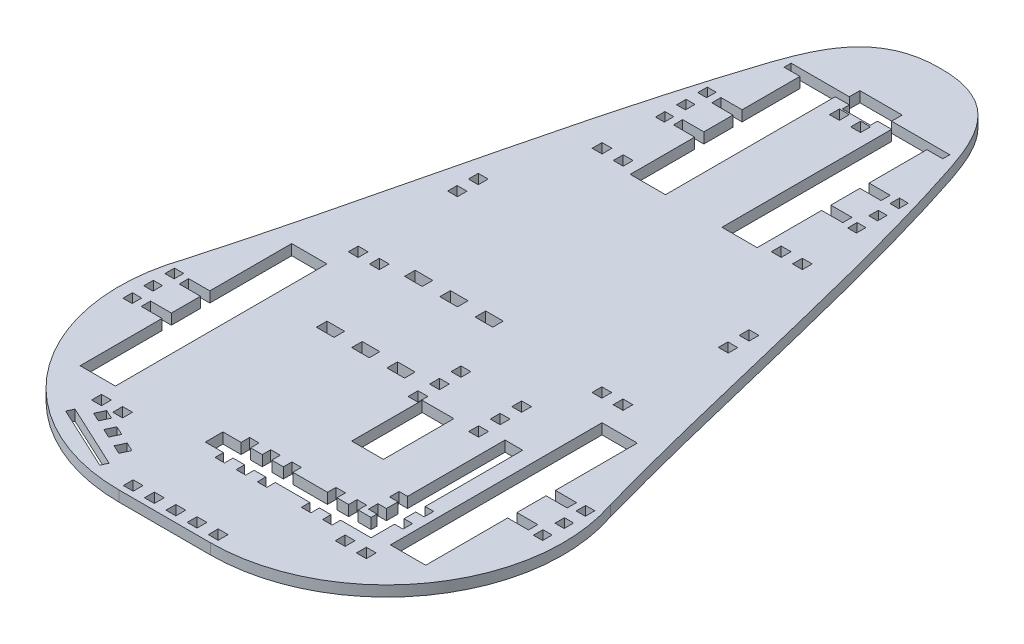
from build123d import *

# Parameters (mm, degrees)
SKETCH1_W           = 2.8
SKETCH1_H           = 2.8
SKETCH1_W_2         = 2.6
SKETCH1_H_2         = 2.7
SKETCH1_W_3         = 5
SKETCH1_H_3         = 3
SKETCH1_W_4         = 2.800000003
SKETCH1_H_4         = 2.800000033
SKETCH1_W_5         = 9
SKETCH1_H_5         = 20
SKETCH1_W_6         = 2.5
BOSS_EXTRUDE1_DEPTH = 3


with BuildPart() as part:
    # Sketch1 → Boss-Extrude1 (new body)
    with BuildSketch(Plane(origin=(0, 0, 0), x_dir=(1, 0, 0), z_dir=(0, 1, 0))):
        with BuildLine():
            ThreePointArc((-5.451969082, 56.808090106), (1.269225254, 11.627257617), (41.903463671, -9.237563161))
            Line((41.903463671, -9.237563161), (44.87196211, -9.237563161))
            Line((44.87196211, -9.237563161), (54.87196211, -9.237563161))
            Line((54.87196211, -9.237563161), (64.87196211, -9.237563161))
            Line((64.87196211, -9.237563161), (67.840460548, -9.237563161))
            ThreePointArc((67.840460548, -9.237563161), (108.474698965, 11.627257617), (115.195893301, 56.808090106))
            add(Edge.make_bspline(
                [(54.87196211, 210.762436839), (55.76190685, 210.762436839), (73.060865178, 210.353018472), (83.092195408, 181.76076755), (97.272209973, 130.317754643), (107.073403848, 85.556994266), (115.195893301, 56.808090106)],
                knots=[0, 0, 0, 0, 0.011071987, 0.221439744, 0.460221348, 1, 1, 1, 1], degree=3))
            add(Edge.make_bspline(
                [(54.87196211, 210.762436839), (53.982017369, 210.762436839), (36.683059042, 210.353018472), (26.651728811, 181.76076755), (12.471714246, 130.317754643), (2.670520371, 85.556994266), (-5.451969082, 56.808090106)],
                knots=[0, 0, 0, 0, 0.011071987, 0.221439744, 0.460221348, 1, 1, 1, 1], degree=3))
        make_face()
        Polygon((33.080876822, -5.87890769), (14.954721126, 2.573457642), (15.799957659, 4.386073211), (33.926113355, -4.06629212), align=None, mode=Mode.SUBTRACT)
        Polygon((24.907374797, 3.44934856), (26.090705944, 5.987010357), (28.628367741, 4.803679211), (27.445036595, 2.266017413), align=None, mode=Mode.SUBTRACT)
        with Locations((17.32012911, 10.362436839)):
            Rectangle(SKETCH1_W, SKETCH1_H, mode=Mode.SUBTRACT)
        Polygon((19.469528089, 5.985058159), (20.652859235, 8.522719957), (23.190521033, 7.33938881), (22.007189886, 4.801727013), align=None, mode=Mode.SUBTRACT)
        with Locations((23.32012911, 10.362436839)):
            Rectangle(SKETCH1_W, SKETCH1_H, mode=Mode.SUBTRACT)
        with Locations((42.82196211, -6.137563532)):
            Rectangle(SKETCH1_W, SKETCH1_H, mode=Mode.SUBTRACT)
        Polygon((30.345221506, 0.91363896), (31.528552652, 3.451300758), (34.06621445, 2.267969611), (32.882883303, -0.269692186), align=None, mode=Mode.SUBTRACT)
        with Locations((48.82196211, -6.137563532)):
            Rectangle(SKETCH1_W, SKETCH1_H, mode=Mode.SUBTRACT)
        with Locations((54.92196211, -6.137563566)):
            Rectangle(SKETCH1_W, SKETCH1_H, mode=Mode.SUBTRACT)
        with Locations((60.92196211, -6.137563532)):
            Rectangle(SKETCH1_W, SKETCH1_H, mode=Mode.SUBTRACT)
        with Locations((-3.328903903, 39.762436839)):
            Rectangle(SKETCH1_W_2, SKETCH1_H_2, mode=Mode.SUBTRACT)
        with Locations((66.92196211, -6.137563532)):
            Rectangle(SKETCH1_W, SKETCH1_H, mode=Mode.SUBTRACT)
        with Locations((86.423795109, 10.362436839)):
            Rectangle(SKETCH1_W, SKETCH1_H, mode=Mode.SUBTRACT)
        with Locations((92.423795109, 10.362436839)):
            Rectangle(SKETCH1_W, SKETCH1_H, mode=Mode.SUBTRACT)
        Polygon((80.72196211, 19.762436839), (84.37196211, 19.762436839), (84.37196211, 21.412436839), (81.97196211, 21.412436839), (81.97196211, 24.112436839), (84.37196211, 24.112436839), (84.37196211, 27.412436839), (81.97196211, 27.412436839), (81.97196211, 30.112436839), (84.37196211, 30.112436839), (84.37196211, 57.762436839), (89.37196211, 57.762436839), (89.37196211, 30.112436839), (91.77196211, 30.112436839), (91.77196211, 27.412436839), (89.37196211, 27.412436839), (89.37196211, 24.112436839), (91.77196211, 24.112436839), (91.77196211, 21.412436839), (89.37196211, 21.412436839), (89.37196211, 19.762436839), (89.37196211, 14.762436839), (84.37196211, 14.762436839), (80.72196211, 14.762436839), (80.72196211, 12.362436839), (78.02196211, 12.362436839), (78.02196211, 14.762436839), (74.72196211, 14.762436839), (74.72196211, 12.362436839), (72.02196211, 12.362436839), (72.02196211, 14.762436839), (62.221962161, 14.762436839), (62.22196211, 12.362436839), (59.52196211, 12.362436839), (59.521962161, 14.762436839), (56.221962161, 14.762436839), (56.22196211, 12.362436839), (53.52196211, 12.362436839), (53.52196211, 14.762436839), (50.22196211, 14.762436839), (50.22196211, 12.362436839), (47.52196211, 12.362436839), (47.52196211, 14.762436839), (42.37196211, 14.762436839), (42.37196211, 19.762436839), (47.52196211, 19.762436839), (47.52196211, 22.162436839), (50.22196211, 22.162436839), (50.22196211, 19.762436839), (53.52196211, 19.762436839), (53.52196211, 22.162436839), (56.22196211, 22.162436839), (56.221962161, 19.762436839), (59.521962161, 19.762436839), (59.52196211, 22.162436839), (62.22196211, 22.162436839), (62.221962161, 19.762436839), (72.02196211, 19.762436839), (72.02196211, 22.162436839), (74.72196211, 22.162436839), (74.72196211, 19.762436839), (78.02196211, 19.762436839), (78.02196211, 22.162436839), (80.72196211, 22.162436839), align=None, mode=Mode.SUBTRACT)
        with Locations((113.072828122, 39.762436839)):
            Rectangle(SKETCH1_W_2, SKETCH1_H_2, mode=Mode.SUBTRACT)
        with Locations((-3.42803789, 45.762436839)):
            Rectangle(SKETCH1_W_2, SKETCH1_H_2, mode=Mode.SUBTRACT)
        with Locations((-3.42803789, 51.762436839)):
            Rectangle(SKETCH1_W_2, SKETCH1_H_2, mode=Mode.SUBTRACT)
        Polygon((5.87196211, 52.537436839), (5.87196211, 75.762436839), (15.87196211, 75.762436839), (15.87196211, 15.762436839), (5.87196211, 15.762436839), (5.87196211, 38.987435462), (-0.028903903, 38.987435462), (-0.028903903, 41.637435462), (5.87196211, 41.637435462), (5.87196211, 49.887436839), (-0.12803789, 49.887436839), (-0.12803789, 52.537436839), align=None, mode=Mode.SUBTRACT)
        with Locations((61.321095984, 56.117167438)):
            Rectangle(SKETCH1_W, SKETCH1_H, mode=Mode.SUBTRACT)
        with Locations((32.421095947, 60.217167702)):
            Rectangle(SKETCH1_W_3, SKETCH1_H_3, mode=Mode.SUBTRACT)
        with Locations((42.421095947, 60.217167702)):
            Rectangle(SKETCH1_W_3, SKETCH1_H_3, mode=Mode.SUBTRACT)
        with Locations((52.421095947, 60.217167702)):
            Rectangle(SKETCH1_W_3, SKETCH1_H_3, mode=Mode.SUBTRACT)
        with Locations((61.321095986, 62.217167405)):
            Rectangle(SKETCH1_W_4, SKETCH1_H, mode=Mode.SUBTRACT)
        with Locations((61.321095986, 68.317167422)):
            Rectangle(SKETCH1_W_4, SKETCH1_H_4, mode=Mode.SUBTRACT)
        with Locations((17.32012911, 83.162436839)):
            Rectangle(SKETCH1_W, SKETCH1_H, mode=Mode.SUBTRACT)
        with Locations((23.32012911, 83.162436839)):
            Rectangle(SKETCH1_W, SKETCH1_H, mode=Mode.SUBTRACT)
        with Locations((32.421095947, 85.217167702)):
            Rectangle(SKETCH1_W_3, SKETCH1_H_3, mode=Mode.SUBTRACT)
        with Locations((42.421095947, 85.217167702)):
            Rectangle(SKETCH1_W_3, SKETCH1_H_3, mode=Mode.SUBTRACT)
        with Locations((52.421095947, 85.217167702)):
            Rectangle(SKETCH1_W_3, SKETCH1_H_3, mode=Mode.SUBTRACT)
        with Locations((67.37196211, 45.762436839)):
            Rectangle(SKETCH1_W_5, SKETCH1_H_5, mode=Mode.SUBTRACT)
        with Locations((78.521095987, 56.117167438)):
            Rectangle(SKETCH1_W, SKETCH1_H, mode=Mode.SUBTRACT)
        Polygon((103.87196211, 38.987435462), (103.87196211, 15.762436839), (93.87196211, 15.762436839), (93.87196211, 75.762436839), (103.87196211, 75.762436839), (103.87196211, 52.537436839), (109.87196211, 52.537436839), (109.87196211, 49.887436839), (103.87196211, 49.887436839), (103.87196211, 41.637435462), (109.772828122, 41.637435462), (109.772828122, 38.987435462), align=None, mode=Mode.SUBTRACT)
        with Locations((78.521095987, 62.217167405)):
            Rectangle(SKETCH1_W, SKETCH1_H, mode=Mode.SUBTRACT)
        with Locations((78.521095987, 68.317167422)):
            Rectangle(SKETCH1_W, SKETCH1_H_4, mode=Mode.SUBTRACT)
        with Locations((113.17196211, 45.762436839)):
            Rectangle(SKETCH1_W_2, SKETCH1_H_2, mode=Mode.SUBTRACT)
        with Locations((113.17196211, 51.762436839)):
            Rectangle(SKETCH1_W_2, SKETCH1_H_2, mode=Mode.SUBTRACT)
        with Locations((86.423795109, 83.162436839)):
            Rectangle(SKETCH1_W, SKETCH1_H, mode=Mode.SUBTRACT)
        with Locations((92.423795109, 83.162436839)):
            Rectangle(SKETCH1_W, SKETCH1_H, mode=Mode.SUBTRACT)
        with Locations((16.47196211, 112.112436839)):
            Rectangle(SKETCH1_W, SKETCH1_H_2, mode=Mode.SUBTRACT)
        with Locations((16.472928842, 118.062436839)):
            Rectangle(SKETCH1_W, SKETCH1_H, mode=Mode.SUBTRACT)
        with Locations((26.47196211, 143.162923042)):
            Rectangle(SKETCH1_W, SKETCH1_H, mode=Mode.SUBTRACT)
        with Locations((32.47196211, 143.162436839)):
            Rectangle(SKETCH1_W, SKETCH1_H, mode=Mode.SUBTRACT)
        with Locations((93.27196211, 112.112436839)):
            Rectangle(SKETCH1_W, SKETCH1_H_2, mode=Mode.SUBTRACT)
        with Locations((93.270995377, 118.062436839)):
            Rectangle(SKETCH1_W, SKETCH1_H, mode=Mode.SUBTRACT)
        with Locations((77.27196211, 143.162436839)):
            Rectangle(SKETCH1_W, SKETCH1_H, mode=Mode.SUBTRACT)
        with Locations((83.27196211, 143.162923042)):
            Rectangle(SKETCH1_W, SKETCH1_H, mode=Mode.SUBTRACT)
        with Locations((27.62196211, 159.762436839)):
            Rectangle(SKETCH1_W_6, SKETCH1_H_2, mode=Mode.SUBTRACT)
        with Locations((27.62196211, 165.762436839)):
            Rectangle(SKETCH1_W_6, SKETCH1_H_2, mode=Mode.SUBTRACT)
        with Locations((27.62196211, 171.762436839)):
            Rectangle(SKETCH1_W_6, SKETCH1_H_2, mode=Mode.SUBTRACT)
        Polygon((36.87196211, 172.487436839), (36.87196211, 188.883995744), (32.37196211, 188.883995744), (32.37196211, 190.883995744), (48.87196211, 190.883995744), (48.87196211, 193.883995744), (60.87196211, 193.883995744), (60.87196211, 190.883995744), (77.37196211, 190.883995744), (77.37196211, 188.883995744), (72.87196211, 188.883995744), (72.87196211, 172.487436839), (78.87196211, 172.487436839), (78.87196211, 169.887436839), (72.87196211, 169.887436839), (72.87196211, 161.637436839), (78.87196211, 161.637436839), (78.87196211, 159.037436839), (72.87196211, 159.037436839), (72.87196211, 140.762436839), (62.87196211, 140.762436839), (62.87196211, 188.883995744), (58.87196211, 188.883995744), (58.87196211, 186.883995744), (50.87196211, 186.883995744), (50.87196211, 188.883995744), (46.87196211, 188.883995744), (46.87196211, 140.762436839), (36.87196211, 140.762436839), (36.87196211, 159.037436839), (30.87196211, 159.037436839), (30.87196211, 161.637436839), (36.87196211, 161.637436839), (36.87196211, 169.887436839), (30.87196211, 169.887436839), (30.87196211, 172.487436839), align=None, mode=Mode.SUBTRACT)
        Polygon((50.47196211, 183.679368755), (50.473853297, 186.479368116), (53.27196211, 186.479368755), (53.27196211, 183.679368755), align=None, mode=Mode.SUBTRACT)
        Polygon((56.47196211, 183.679368755), (56.47196211, 186.479368755), (59.270070922, 186.479368116), (59.27196211, 183.679368755), align=None, mode=Mode.SUBTRACT)
        with Locations((82.12196211, 159.762436839)):
            Rectangle(SKETCH1_W_6, SKETCH1_H_2, mode=Mode.SUBTRACT)
        with Locations((82.12196211, 165.762436839)):
            Rectangle(SKETCH1_W_6, SKETCH1_H_2, mode=Mode.SUBTRACT)
        with Locations((82.12196211, 171.762436839)):
            Rectangle(SKETCH1_W_6, SKETCH1_H_2, mode=Mode.SUBTRACT)
    extrude(amount=BOSS_EXTRUDE1_DEPTH)


solid = part.part
